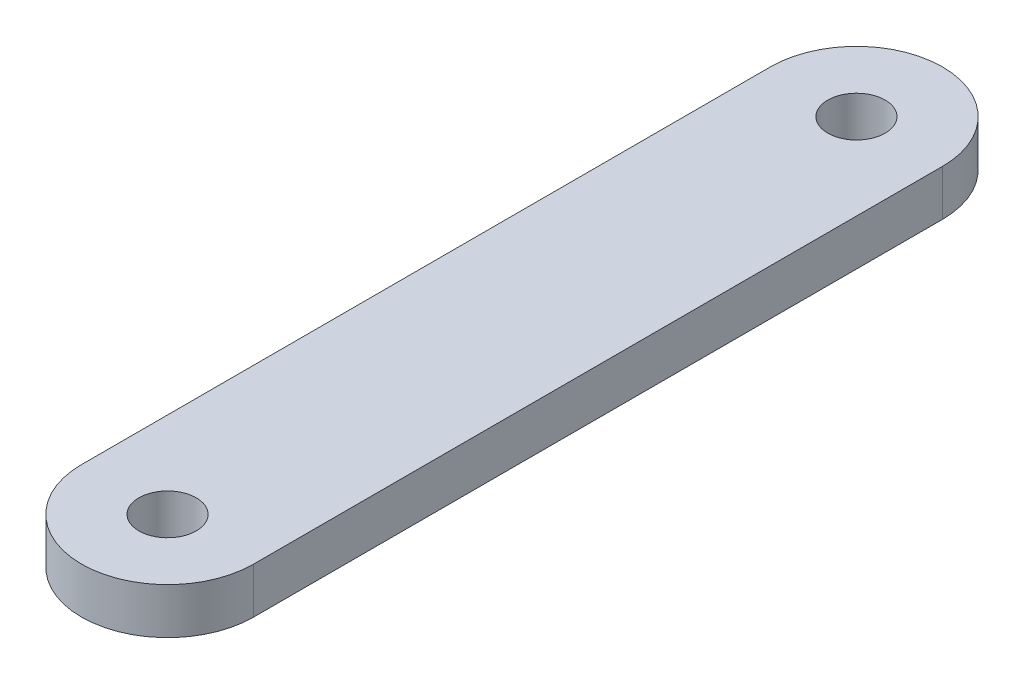
from build123d import *

# Parameters (mm, degrees)
SKETCH1_R           = 1.5875
BOSS_EXTRUDE1_DEPTH = 2.54


with BuildPart() as part:
    # Sketch1 → Boss-Extrude1 (new body)
    with BuildSketch(Plane(origin=(0, 0, 0), x_dir=(1, 0, 0), z_dir=(0, 1, 0))):
        with BuildLine():
            Line((4.7625, 38.1), (4.7625, 0))
            ThreePointArc((4.7625, 0), (0, -4.7625), (-4.7625, 0))
            Line((-4.7625, 0), (-4.7625, 38.1))
            ThreePointArc((-4.7625, 38.1), (0, 42.8625), (4.7625, 38.1))
        make_face()
        Circle(SKETCH1_R, mode=Mode.SUBTRACT)
        with Locations((0, 38.1)):
            Circle(SKETCH1_R, mode=Mode.SUBTRACT)
    extrude(amount=BOSS_EXTRUDE1_DEPTH)


solid = part.part
